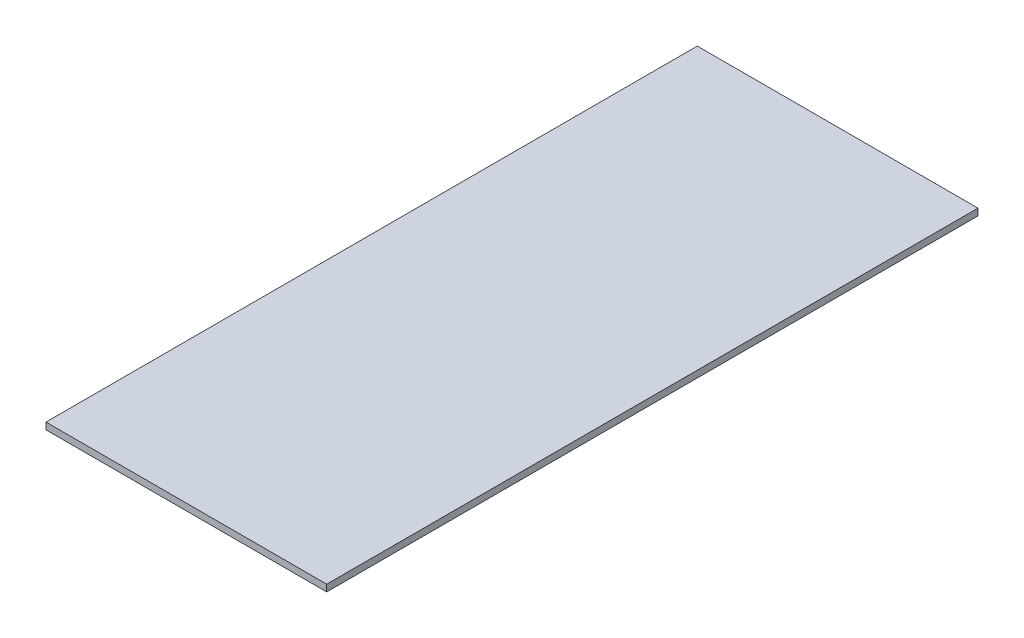
from build123d import *

# Parameters (mm, degrees)
ESBO_O1_W                = 250
ESBO_O1_H                = 475
RESSALTO_EXTRUS_O1_DEPTH = 6
ESBO_O2_W                = 250
ESBO_O2_H                = 6
RESSALTO_EXTRUS_O2_DEPTH = 25
ESBO_O3_W                = 250
ESBO_O3_H                = 6
RESSALTO_EXTRUS_O4_DEPTH = 80


with BuildPart() as part:
    # Esboço1 → Ressalto-extrusão1 (new body)
    with BuildSketch(Plane(origin=(0, 0, 0), x_dir=(1, 0, 0), z_dir=(0, 1, 0))):
        with Locations((125, -237.5)):
            Rectangle(ESBO_O1_W, ESBO_O1_H)
    extrude(amount=RESSALTO_EXTRUS_O1_DEPTH)

    # Esboço2 → Ressalto-extrusão2 (add)
    with BuildSketch(Plane(origin=(0, 0, 0), x_dir=(-1, 0, 0), z_dir=(0, 0, -1))):
        with Locations((-125, 3)):
            Rectangle(ESBO_O2_W, ESBO_O2_H)
    extrude(amount=RESSALTO_EXTRUS_O2_DEPTH)

    # Esboço3 → Ressalto-extrusão4 (add)
    with BuildSketch(Plane(origin=(0, 0, -25), x_dir=(-1, 0, 0), z_dir=(0, 0, -1))):
        with Locations((-125, 3)):
            Rectangle(ESBO_O3_W, ESBO_O3_H)
    extrude(amount=RESSALTO_EXTRUS_O4_DEPTH)


solid = part.part
